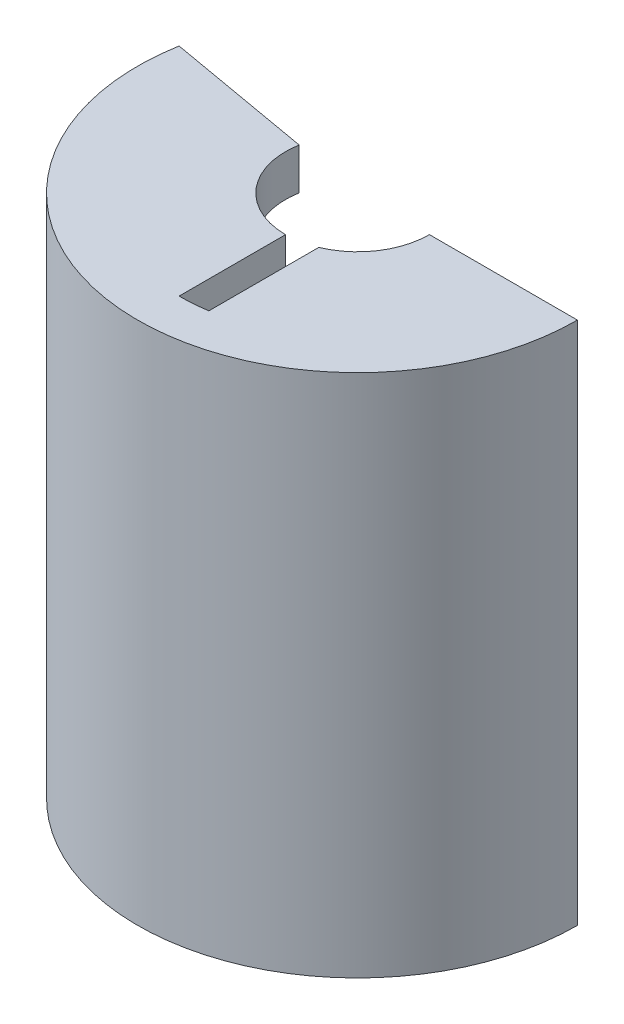
from build123d import *
from build123d.topology import SkipClean

# Parameters (mm, degrees)
REVOLVE1_ANGLE     = 190
CUT_EXTRUDE1_DEPTH = 45.06204684


with BuildPart() as part:
    # Sketch1 → Revolve1 (revolve)
    with BuildSketch(Plane.XY):
        Polygon((5.2, 102.642966667), (5.2, 99.642966667), (12.897098368, 99.642966667), (12.897098368, 77.4), (9.725, 77.4), (9.725, 67.748), (2.7, 67.748), (2.7, 64.748), (15.897098368, 64.748), (15.897098368, 102.642966667), align=None)
    revolve(axis=Axis((0, 104.537715, 0), (0, -1, 0)), revolution_arc=REVOLVE1_ANGLE)

    # Sketch2 → Cut-Extrude1 (cut, through all)
    with SkipClean():  # the faces are left unmerged after this step: merging them gives an invalid solid
        with BuildSketch(Plane(origin=(0, 102.642966667, 0), x_dir=(1, 0, 0), z_dir=(0, 1, 0))):
            with BuildLine():
                Line((0, 0), (0, -12.897098368))
                ThreePointArc((0, -12.897098368), (1.002621368, -12.858067378), (1.999174193, -12.741210651))
                Line((1.999174193, -12.741210651), (1.999174193, 0))
                Line((1.999174193, 0), (0, 0))
            make_face()
        extrude(amount=-CUT_EXTRUDE1_DEPTH, mode=Mode.SUBTRACT)


solid = part.part
